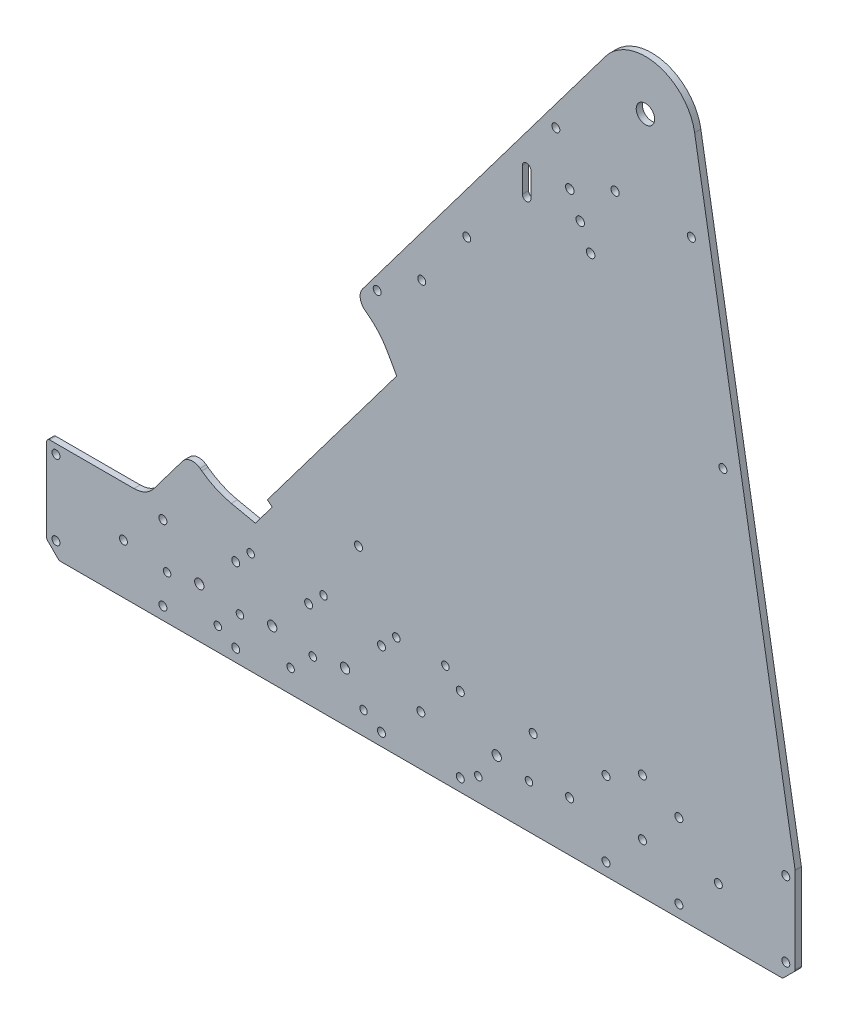
from build123d import *

# Parameters (mm, degrees)
BOSS_EXTRUDE1_DEPTH = 3.175
CUT_EXTRUDE1_REACH  = 534.132
SKETCH2_R           = 2.032
SKETCH5_R           = 2.032
SKETCH5_R_2         = 2.38125
CUT_EXTRUDE4_DEPTH  = 533.132273265
SKETCH6_R           = 2.032
CUT_EXTRUDE5_DEPTH  = 533.132273265
SKETCH3_R           = 4.699
SKETCH3_R_2         = 2.032
SKETCH3_R_3         = 2.0955
SKETCH3_R_4         = 2.159
CUT_EXTRUDE2_DEPTH  = 533.132273265
FILLET1_R           = 1.5875
CUT_EXTRUDE3_REACH  = 534.132
SKETCH4_R           = 1.905
FILLET2_R           = 38.1
FILLET3_R           = 6.35


with BuildPart() as part:
    # Sketch1 → Boss-Extrude1 (new body)
    with BuildSketch(Plane.XY):
        with BuildLine():
            Line((0, 0), (381, 0))
            Line((381, 0), (381, 50.8))
            Line((381, 50.8), (329.837432577, 350.351326687))
            ThreePointArc((329.837432577, 350.351326687), (310.787920632, 370.759100277), (284.504927721, 361.348180455))
            Line((284.504927721, 361.348180455), (157.027492501, 191.955579526))
            Line((157.027492501, 191.955579526), (169.711912675, 182.409841741))
            Line((169.711912675, 182.409841741), (178.167615548, 167.244965001))
            Line((178.167615548, 167.244965001), (112.326505112, 79.754995301))
            Line((112.326505112, 79.754995301), (114.863389147, 77.845847744))
            Line((114.863389147, 77.845847744), (106.272225141, 66.429869588))
            Line((106.272225141, 66.429869588), (85.709420174, 70.786944209))
            Line((85.709420174, 70.786944209), (73.025, 80.332681993))
            Line((73.025, 80.332681993), (54.610499914, 55.863409773))
            ThreePointArc((54.610499914, 55.863409773), (50.133294634, 52.136138511), (44.462963775, 50.8))
            Line((44.462963775, 50.8), (0, 50.8))
            Line((0, 50.8), (0, 0))
        make_face()
    extrude(amount=BOSS_EXTRUDE1_DEPTH)

    # Sketch2 → Cut-Extrude1 (cut, up to next)
    with BuildSketch(Plane.XY.offset(3.175), mode=Mode.PRIVATE) as cut_extrude1_sk1:
        with Locations((4.7625, 46.0375)):
            Circle(SKETCH2_R)
    cut_extrude1_tool1 = extrude(cut_extrude1_sk1.sketch, amount=-CUT_EXTRUDE1_REACH, mode=Mode.PRIVATE) & part.part
    # Sketch2 → Cut-Extrude1 (cut, up to next)
    with BuildSketch(Plane.XY.offset(3.175), mode=Mode.PRIVATE) as cut_extrude1_sk2:
        with Locations((4.7625, 7.9375)):
            Circle(SKETCH2_R)
    cut_extrude1_tool2 = extrude(cut_extrude1_sk2.sketch, amount=-CUT_EXTRUDE1_REACH, mode=Mode.PRIVATE) & part.part
    # Sketch2 → Cut-Extrude1 (cut, up to next)
    with BuildSketch(Plane.XY.offset(3.175), mode=Mode.PRIVATE) as cut_extrude1_sk3:
        with Locations((376.2375, 7.9375)):
            Circle(SKETCH2_R)
    cut_extrude1_tool3 = extrude(cut_extrude1_sk3.sketch, amount=-CUT_EXTRUDE1_REACH, mode=Mode.PRIVATE) & part.part
    # Sketch2 → Cut-Extrude1 (cut, up to next)
    with BuildSketch(Plane.XY.offset(3.175), mode=Mode.PRIVATE) as cut_extrude1_sk4:
        with Locations((376.2375, 46.0375)):
            Circle(SKETCH2_R)
    cut_extrude1_tool4 = extrude(cut_extrude1_sk4.sketch, amount=-CUT_EXTRUDE1_REACH, mode=Mode.PRIVATE) & part.part
    # Sketch2 → Cut-Extrude1 (cut, up to next)
    with BuildSketch(Plane.XY.offset(3.175), mode=Mode.PRIVATE) as cut_extrude1_sk5:
        Polygon((0, 6.35), (0, 0), (6.35, 0), align=None)
    cut_extrude1_tool5 = extrude(cut_extrude1_sk5.sketch, amount=-CUT_EXTRUDE1_REACH, mode=Mode.PRIVATE) & part.part
    # Sketch2 → Cut-Extrude1 (cut, up to next)
    with BuildSketch(Plane.XY.offset(3.175), mode=Mode.PRIVATE) as cut_extrude1_sk6:
        Polygon((381, 0), (374.65, 0), (381, 6.35), align=None)
    cut_extrude1_tool6 = extrude(cut_extrude1_sk6.sketch, amount=-CUT_EXTRUDE1_REACH, mode=Mode.PRIVATE) & part.part
    add(cut_extrude1_tool1.solids().sort_by_distance((4.7625, 46.0375, 3.175))[0], mode=Mode.SUBTRACT)
    add(cut_extrude1_tool2.solids().sort_by_distance((4.7625, 7.9375, 3.175))[0], mode=Mode.SUBTRACT)
    add(cut_extrude1_tool3.solids().sort_by_distance((376.2375, 7.9375, 3.175))[0], mode=Mode.SUBTRACT)
    add(cut_extrude1_tool4.solids().sort_by_distance((376.2375, 46.0375, 3.175))[0], mode=Mode.SUBTRACT)
    add(cut_extrude1_tool5.solids().sort_by_distance((2.116667, 2.116667, 3.175))[0], mode=Mode.SUBTRACT)
    add(cut_extrude1_tool6.solids().sort_by_distance((378.883333, 2.116667, 3.175))[0], mode=Mode.SUBTRACT)

    # Sketch5 → Cut-Extrude4 (cut, through all)
    with BuildSketch(Plane.XY.offset(3.175)):
        with Locations((39.116, 25.4)):
            Circle(SKETCH5_R)
        with Locations((59.182, 6.35)):
            Circle(SKETCH5_R)
        with Locations((59.182, 44.45)):
            Circle(SKETCH5_R)
        with Locations((96.266, 44.45)):
            Circle(SKETCH5_R)
        with Locations((133.35, 44.45)):
            Circle(SKETCH5_R)
        with Locations((170.434, 44.45)):
            Circle(SKETCH5_R)
        with Locations((210.566, 44.45)):
            Circle(SKETCH5_R)
        with Locations((210.566, 6.35)):
            Circle(SKETCH5_R)
        with Locations((170.434, 6.35)):
            Circle(SKETCH5_R)
        with Locations((247.65, 44.45)):
            Circle(SKETCH5_R)
        with Locations((266.192, 25.4)):
            Circle(SKETCH5_R)
        with Locations((77.724, 25.4)):
            Circle(SKETCH5_R_2)
        with Locations((114.808, 25.4)):
            Circle(SKETCH5_R_2)
        with Locations((151.892, 25.4)):
            Circle(SKETCH5_R_2)
        with Locations((229.108, 25.4)):
            Circle(SKETCH5_R_2)
        with Locations((190.5, 25.4)):
            Circle(SKETCH5_R)
        with Locations((303.276, 25.4)):
            Circle(SKETCH5_R)
        with Locations((341.884, 25.4)):
            Circle(SKETCH5_R)
    extrude(amount=-CUT_EXTRUDE4_DEPTH, mode=Mode.SUBTRACT)

    # Sketch6 → Cut-Extrude5 (cut, through all)
    with BuildSketch(Plane.XY.offset(3.175)):
        with Locations((284.734, 44.45)):
            Circle(SKETCH6_R)
        with Locations((284.734, 6.35)):
            Circle(SKETCH6_R)
        with Locations((321.818, 6.35)):
            Circle(SKETCH6_R)
        with Locations((321.818, 44.45)):
            Circle(SKETCH6_R)
        with Locations((96.266, 6.35)):
            Circle(SKETCH6_R)
        with Locations((303.276, 53.975)):
            Circle(SKETCH6_R)
    extrude(amount=-CUT_EXTRUDE5_DEPTH, mode=Mode.SUBTRACT)

    # Sketch3 → Cut-Extrude2 (cut, through all)
    with BuildSketch(Plane.XY.offset(3.175)):
        with Locations((304.8, 346.075)):
            Circle(SKETCH3_R)
        with Locations((168.275, 200.025)):
            Circle(SKETCH3_R_2)
        with Locations((158.75, 82.55)):
            Circle(SKETCH3_R_2)
        with Locations((289.373209699, 304.387871998)):
            Circle(SKETCH3_R_3)
        with Locations((266.295701738, 293.777093219)):
            Circle(SKETCH3_R_4)
        with Locations((271.601091128, 282.238339238)):
            Circle(SKETCH3_R_4)
        with Locations((276.906480518, 270.699585258)):
            Circle(SKETCH3_R_4)
        with Locations((328.186766793, 303.440372165)):
            Circle(SKETCH3_R_2)
        with Locations((344.222991868, 209.55)):
            Circle(SKETCH3_R_2)
        with Locations((259.211844923, 317.178274551)):
            Circle(SKETCH3_R_2)
        with Locations((213.851281588, 246.342608418)):
            Circle(SKETCH3_R_2)
        with Locations((190.941510906, 215.9)):
            Circle(SKETCH3_R_2)
        with BuildLine():
            Line((242.153661094, 279.4), (242.153661094, 292.1))
            ThreePointArc((242.153661094, 292.1), (244.312661094, 294.259), (246.471661094, 292.1))
            Line((246.471661094, 292.1), (246.471661094, 279.4))
            ThreePointArc((246.471661094, 279.4), (244.312661094, 277.241), (242.153661094, 279.4))
        make_face()
    extrude(amount=-CUT_EXTRUDE2_DEPTH, mode=Mode.SUBTRACT)

    # Fillet1
    fillet1_edges = [part.edges().sort_by_distance(p)[0] for p in [
        (374.65, 0, 1.5875),
        (381, 6.35, 1.5875),
        (381, 50.8, 1.5875),
        (6.35, 0, 1.5875),
        (0, 6.35, 1.5875),
        (0, 50.8, 1.5875),
    ]]
    fillet(fillet1_edges, radius=FILLET1_R)

    # Sketch4 → Cut-Extrude3 (cut, up to next)
    with BuildSketch(Plane(origin=(0, 0, 0), x_dir=(-1, 0, 0), z_dir=(0, 0, -1)), mode=Mode.PRIVATE) as cut_extrude3_sk1:
        with Locations((-61.318145625, 22.298133105)):
            Circle(SKETCH4_R)
    cut_extrude3_tool1 = extrude(cut_extrude3_sk1.sketch, amount=-CUT_EXTRUDE3_REACH, mode=Mode.PRIVATE) & part.part
    # Sketch4 → Cut-Extrude3 (cut, up to next)
    with BuildSketch(Plane(origin=(0, 0, 0), x_dir=(-1, 0, 0), z_dir=(0, 0, -1)), mode=Mode.PRIVATE) as cut_extrude3_sk2:
        with Locations((-87.131339764, 11.605958005)):
            Circle(SKETCH4_R)
    cut_extrude3_tool2 = extrude(cut_extrude3_sk2.sketch, amount=-CUT_EXTRUDE3_REACH, mode=Mode.PRIVATE) & part.part
    # Sketch4 → Cut-Extrude3 (cut, up to next)
    with BuildSketch(Plane(origin=(0, 0, 0), x_dir=(-1, 0, 0), z_dir=(0, 0, -1)), mode=Mode.PRIVATE) as cut_extrude3_sk3:
        with Locations((-98.402145625, 22.298133105)):
            Circle(SKETCH4_R)
    cut_extrude3_tool3 = extrude(cut_extrude3_sk3.sketch, amount=-CUT_EXTRUDE3_REACH, mode=Mode.PRIVATE) & part.part
    # Sketch4 → Cut-Extrude3 (cut, up to next)
    with BuildSketch(Plane(origin=(0, 0, 0), x_dir=(-1, 0, 0), z_dir=(0, 0, -1)), mode=Mode.PRIVATE) as cut_extrude3_sk4:
        with Locations((-124.215339764, 11.605958005)):
            Circle(SKETCH4_R)
    cut_extrude3_tool4 = extrude(cut_extrude3_sk4.sketch, amount=-CUT_EXTRUDE3_REACH, mode=Mode.PRIVATE) & part.part
    # Sketch4 → Cut-Extrude3 (cut, up to next)
    with BuildSketch(Plane(origin=(0, 0, 0), x_dir=(-1, 0, 0), z_dir=(0, 0, -1)), mode=Mode.PRIVATE) as cut_extrude3_sk5:
        with Locations((-135.486145625, 22.298133105)):
            Circle(SKETCH4_R)
    cut_extrude3_tool5 = extrude(cut_extrude3_sk5.sketch, amount=-CUT_EXTRUDE3_REACH, mode=Mode.PRIVATE) & part.part
    # Sketch4 → Cut-Extrude3 (cut, up to next)
    with BuildSketch(Plane(origin=(0, 0, 0), x_dir=(-1, 0, 0), z_dir=(0, 0, -1)), mode=Mode.PRIVATE) as cut_extrude3_sk6:
        with Locations((-161.299339764, 11.605958005)):
            Circle(SKETCH4_R)
    cut_extrude3_tool6 = extrude(cut_extrude3_sk6.sketch, amount=-CUT_EXTRUDE3_REACH, mode=Mode.PRIVATE) & part.part
    # Sketch4 → Cut-Extrude3 (cut, up to next)
    with BuildSketch(Plane(origin=(0, 0, 0), x_dir=(-1, 0, 0), z_dir=(0, 0, -1)), mode=Mode.PRIVATE) as cut_extrude3_sk7:
        with Locations((-245.513854375, 22.298133105)):
            Circle(SKETCH4_R)
    cut_extrude3_tool7 = extrude(cut_extrude3_sk7.sketch, amount=-CUT_EXTRUDE3_REACH, mode=Mode.PRIVATE) & part.part
    # Sketch4 → Cut-Extrude3 (cut, up to next)
    with BuildSketch(Plane(origin=(0, 0, 0), x_dir=(-1, 0, 0), z_dir=(0, 0, -1)), mode=Mode.PRIVATE) as cut_extrude3_sk8:
        with Locations((-219.700660236, 11.605958005)):
            Circle(SKETCH4_R)
    cut_extrude3_tool8 = extrude(cut_extrude3_sk8.sketch, amount=-CUT_EXTRUDE3_REACH, mode=Mode.PRIVATE) & part.part
    # Sketch4 → Cut-Extrude3 (cut, up to next)
    with BuildSketch(Plane(origin=(0, 0, 0), x_dir=(-1, 0, 0), z_dir=(0, 0, -1)), mode=Mode.PRIVATE) as cut_extrude3_sk9:
        with Locations((-202.981986443, 51.968407021)):
            Circle(SKETCH4_R)
    cut_extrude3_tool9 = extrude(cut_extrude3_sk9.sketch, amount=-CUT_EXTRUDE3_REACH, mode=Mode.PRIVATE) & part.part
    # Sketch4 → Cut-Extrude3 (cut, up to next)
    with BuildSketch(Plane(origin=(0, 0, 0), x_dir=(-1, 0, 0), z_dir=(0, 0, -1)), mode=Mode.PRIVATE) as cut_extrude3_sk10:
        with Locations((-178.018013557, 51.968407021)):
            Circle(SKETCH4_R)
    cut_extrude3_tool10 = extrude(cut_extrude3_sk10.sketch, amount=-CUT_EXTRUDE3_REACH, mode=Mode.PRIVATE) & part.part
    # Sketch4 → Cut-Extrude3 (cut, up to next)
    with BuildSketch(Plane(origin=(0, 0, 0), x_dir=(-1, 0, 0), z_dir=(0, 0, -1)), mode=Mode.PRIVATE) as cut_extrude3_sk11:
        with Locations((-140.934013557, 51.968407021)):
            Circle(SKETCH4_R)
    cut_extrude3_tool11 = extrude(cut_extrude3_sk11.sketch, amount=-CUT_EXTRUDE3_REACH, mode=Mode.PRIVATE) & part.part
    # Sketch4 → Cut-Extrude3 (cut, up to next)
    with BuildSketch(Plane(origin=(0, 0, 0), x_dir=(-1, 0, 0), z_dir=(0, 0, -1)), mode=Mode.PRIVATE) as cut_extrude3_sk12:
        with Locations((-103.850013557, 51.968407021)):
            Circle(SKETCH4_R)
    cut_extrude3_tool12 = extrude(cut_extrude3_sk12.sketch, amount=-CUT_EXTRUDE3_REACH, mode=Mode.PRIVATE) & part.part
    add(cut_extrude3_tool1.solids().sort_by_distance((61.318146, 22.298133, 0))[0], mode=Mode.SUBTRACT)
    add(cut_extrude3_tool2.solids().sort_by_distance((87.13134, 11.605958, 0))[0], mode=Mode.SUBTRACT)
    add(cut_extrude3_tool3.solids().sort_by_distance((98.402146, 22.298133, 0))[0], mode=Mode.SUBTRACT)
    add(cut_extrude3_tool4.solids().sort_by_distance((124.21534, 11.605958, 0))[0], mode=Mode.SUBTRACT)
    add(cut_extrude3_tool5.solids().sort_by_distance((135.486146, 22.298133, 0))[0], mode=Mode.SUBTRACT)
    add(cut_extrude3_tool6.solids().sort_by_distance((161.29934, 11.605958, 0))[0], mode=Mode.SUBTRACT)
    add(cut_extrude3_tool7.solids().sort_by_distance((245.513854, 22.298133, 0))[0], mode=Mode.SUBTRACT)
    add(cut_extrude3_tool8.solids().sort_by_distance((219.70066, 11.605958, 0))[0], mode=Mode.SUBTRACT)
    add(cut_extrude3_tool9.solids().sort_by_distance((202.981986, 51.968407, 0))[0], mode=Mode.SUBTRACT)
    add(cut_extrude3_tool10.solids().sort_by_distance((178.018014, 51.968407, 0))[0], mode=Mode.SUBTRACT)
    add(cut_extrude3_tool11.solids().sort_by_distance((140.934014, 51.968407, 0))[0], mode=Mode.SUBTRACT)
    add(cut_extrude3_tool12.solids().sort_by_distance((103.850014, 51.968407, 0))[0], mode=Mode.SUBTRACT)

    # Fillet2
    fillet2_edges = [part.edges().sort_by_distance(p)[0] for p in [
        (85.709420174, 70.786944209, 1.5875),
        (169.711912675, 182.409841741, 1.5875),
    ]]
    fillet(fillet2_edges, radius=FILLET2_R)

    # Fillet3
    fillet3_edges = [part.edges().sort_by_distance(p)[0] for p in [
        (73.025, 80.332681993, 1.5875),
        (157.027492501, 191.955579526, 1.5875),
    ]]
    fillet(fillet3_edges, radius=FILLET3_R)


solid = part.part
